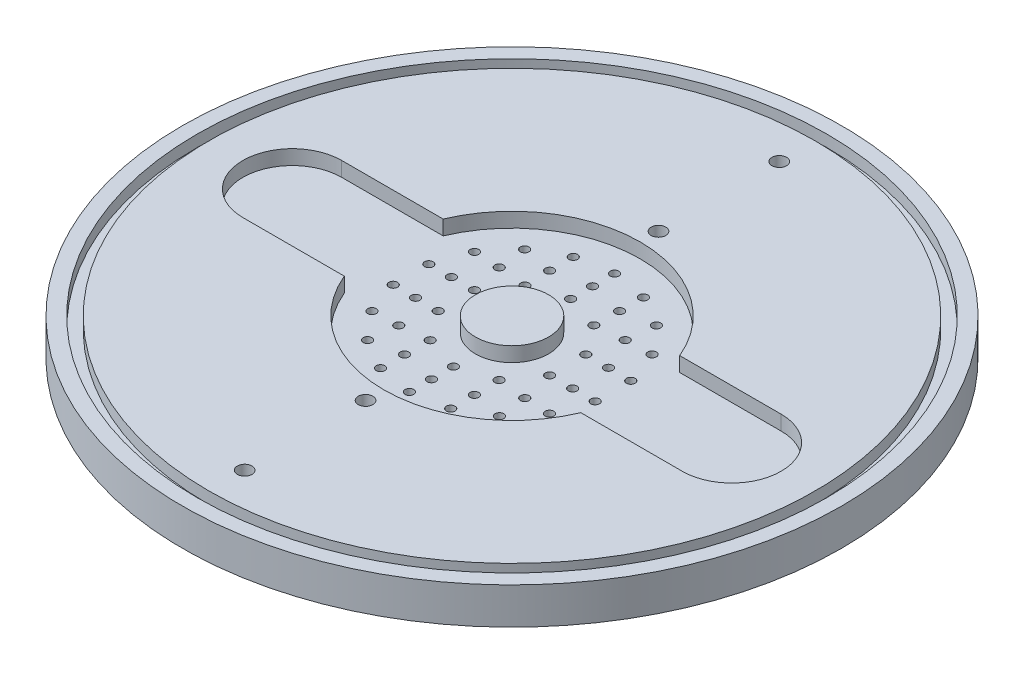
from build123d import *

# Parameters (mm, degrees)
MAIN_SHAPE_PROFILE_W          = 57.15
MAIN_SHAPE_PROFILE_H          = 6.35
O_RINGS_PROFILE_W             = 2.032
O_RINGS_PROFILE_H             = 2.032
INJECTOR_WELL_PROFILE_R       = 6.35
INJECTOR_WELL_DEPTH           = 2.54
DOWEL_HOLES_PROFILE_R         = 1.27
DOWEL_HOLES_DEPTH             = 2.54
INJECTOR_HOLES_R              = 0.7493
CIRCULAR_INJECTOR_HOLES_DEPTH = 81.912057816


with BuildPart() as part:
    # Main Shape Profile → Main Shape (revolve)
    with BuildSketch(Plane.XY):
        with Locations((28.575, 3.175)):
            Rectangle(MAIN_SHAPE_PROFILE_W, MAIN_SHAPE_PROFILE_H)
    revolve(axis=Axis((0, 0, 0), (0, -1, 0)))

    # O Rings Profile → O-Rings Cutout (revolve, cut)
    with BuildSketch(Plane.XY):
        with Locations((53.594, 5.334)):
            Rectangle(O_RINGS_PROFILE_W, O_RINGS_PROFILE_H)
        with Locations((53.594, 1.016)):
            Rectangle(O_RINGS_PROFILE_W, O_RINGS_PROFILE_H)
    revolve(axis=Axis((0, 0, 0), (0, -1, 0)), mode=Mode.SUBTRACT)

    # Injector Well Profile → Injector Well (cut)
    with BuildSketch(Plane(origin=(0, 6.35, 0), x_dir=(1, 0, 0), z_dir=(0, 1, 0))):
        with BuildLine():
            Line((-38.1, 8.57504), (-20.504129194, 8.57504))
            ThreePointArc((-20.504129194, 8.57504), (0, 22.225), (20.504129194, 8.57504))
            Line((20.504129194, 8.57504), (38.1, 8.57504))
            ThreePointArc((38.1, 8.57504), (46.67504, 0), (38.1, -8.57504))
            Line((38.1, -8.57504), (20.504129194, -8.57504))
            ThreePointArc((20.504129194, -8.57504), (0, -22.225), (-20.504129194, -8.57504))
            Line((-20.504129194, -8.57504), (-38.1, -8.57504))
            ThreePointArc((-38.1, -8.57504), (-46.67504, 0), (-38.1, 8.57504))
        make_face()
        Circle(INJECTOR_WELL_PROFILE_R, mode=Mode.SUBTRACT)
    extrude(amount=-INJECTOR_WELL_DEPTH, mode=Mode.SUBTRACT)

    # Dowel Holes Profile → Dowel Holes (cut)
    with BuildSketch(Plane(origin=(0, 6.35, 0), x_dir=(1, 0, 0), z_dir=(0, 1, 0))):
        with Locations((0, 25.4)):
            Circle(DOWEL_HOLES_PROFILE_R)
        with Locations((0, 46.355)):
            Circle(DOWEL_HOLES_PROFILE_R)
        with Locations((0, -46.355)):
            Circle(DOWEL_HOLES_PROFILE_R)
        with Locations((0, -25.4)):
            Circle(DOWEL_HOLES_PROFILE_R)
    extrude(amount=-DOWEL_HOLES_DEPTH, mode=Mode.SUBTRACT)

    # Injector Holes → Circular Injector Holes (cut, through all)
    with BuildSketch(Plane(origin=(0, 3.81, 0), x_dir=(1, 0, 0), z_dir=(0, 1, 0))):
        with Locations((0, -17.78)):
            Circle(INJECTOR_HOLES_R)
        with Locations((0, -13.97)):
            Circle(INJECTOR_HOLES_R)
        with Locations((0, -10.16)):
            Circle(INJECTOR_HOLES_R)
        with Locations((-6.081118148, -16.707734798)):
            Circle(INJECTOR_HOLES_R)
        with Locations((-11.4287637, -13.620270199)):
            Circle(INJECTOR_HOLES_R)
        with Locations((-15.397931679, -8.89)):
            Circle(INJECTOR_HOLES_R)
        with Locations((-17.509881849, -3.087464599)):
            Circle(INJECTOR_HOLES_R)
        with Locations((-17.509881849, 3.087464599)):
            Circle(INJECTOR_HOLES_R)
        with Locations((-15.397931679, 8.89)):
            Circle(INJECTOR_HOLES_R)
        with Locations((-11.4287637, 13.620270199)):
            Circle(INJECTOR_HOLES_R)
        with Locations((-6.081118148, 16.707734798)):
            Circle(INJECTOR_HOLES_R)
        with Locations((0, 17.78)):
            Circle(INJECTOR_HOLES_R)
        with Locations((6.081118148, 16.707734798)):
            Circle(INJECTOR_HOLES_R)
        with Locations((11.4287637, 13.620270199)):
            Circle(INJECTOR_HOLES_R)
        with Locations((15.397931679, 8.89)):
            Circle(INJECTOR_HOLES_R)
        with Locations((17.509881849, 3.087464599)):
            Circle(INJECTOR_HOLES_R)
        with Locations((17.509881849, -3.087464599)):
            Circle(INJECTOR_HOLES_R)
        with Locations((15.397931679, -8.89)):
            Circle(INJECTOR_HOLES_R)
        with Locations((11.4287637, -13.620270199)):
            Circle(INJECTOR_HOLES_R)
        with Locations((-6.061355835, -12.586535085)):
            Circle(INJECTOR_HOLES_R)
        with Locations((-10.92218581, -8.710152532)):
            Circle(INJECTOR_HOLES_R)
        with Locations((-13.619742933, -3.108617447)):
            Circle(INJECTOR_HOLES_R)
        with Locations((-13.619742933, 3.108617447)):
            Circle(INJECTOR_HOLES_R)
        with Locations((-10.92218581, 8.710152532)):
            Circle(INJECTOR_HOLES_R)
        with Locations((-6.061355835, 12.586535085)):
            Circle(INJECTOR_HOLES_R)
        with Locations((0, 13.97)):
            Circle(INJECTOR_HOLES_R)
        with Locations((6.061355835, 12.586535085)):
            Circle(INJECTOR_HOLES_R)
        with Locations((10.92218581, 8.710152532)):
            Circle(INJECTOR_HOLES_R)
        with Locations((13.619742933, 3.108617447)):
            Circle(INJECTOR_HOLES_R)
        with Locations((13.619742933, -3.108617447)):
            Circle(INJECTOR_HOLES_R)
        with Locations((10.92218581, -8.710152532)):
            Circle(INJECTOR_HOLES_R)
        with Locations((-5.971898163, -8.219612663)):
            Circle(INJECTOR_HOLES_R)
        with Locations((-9.662734206, -3.139612663)):
            Circle(INJECTOR_HOLES_R)
        with Locations((-9.662734206, 3.139612663)):
            Circle(INJECTOR_HOLES_R)
        with Locations((-5.971898163, 8.219612663)):
            Circle(INJECTOR_HOLES_R)
        with Locations((0, 10.16)):
            Circle(INJECTOR_HOLES_R)
        with Locations((5.971898163, 8.219612663)):
            Circle(INJECTOR_HOLES_R)
        with Locations((9.662734206, 3.139612663)):
            Circle(INJECTOR_HOLES_R)
        with Locations((9.662734206, -3.139612663)):
            Circle(INJECTOR_HOLES_R)
        with Locations((5.971898163, -8.219612663)):
            Circle(INJECTOR_HOLES_R)
        with Locations((6.061355835, -12.586535085)):
            Circle(INJECTOR_HOLES_R)
        with Locations((6.081118148, -16.707734798)):
            Circle(INJECTOR_HOLES_R)
    extrude(amount=-CIRCULAR_INJECTOR_HOLES_DEPTH, mode=Mode.SUBTRACT)


solid = part.part
